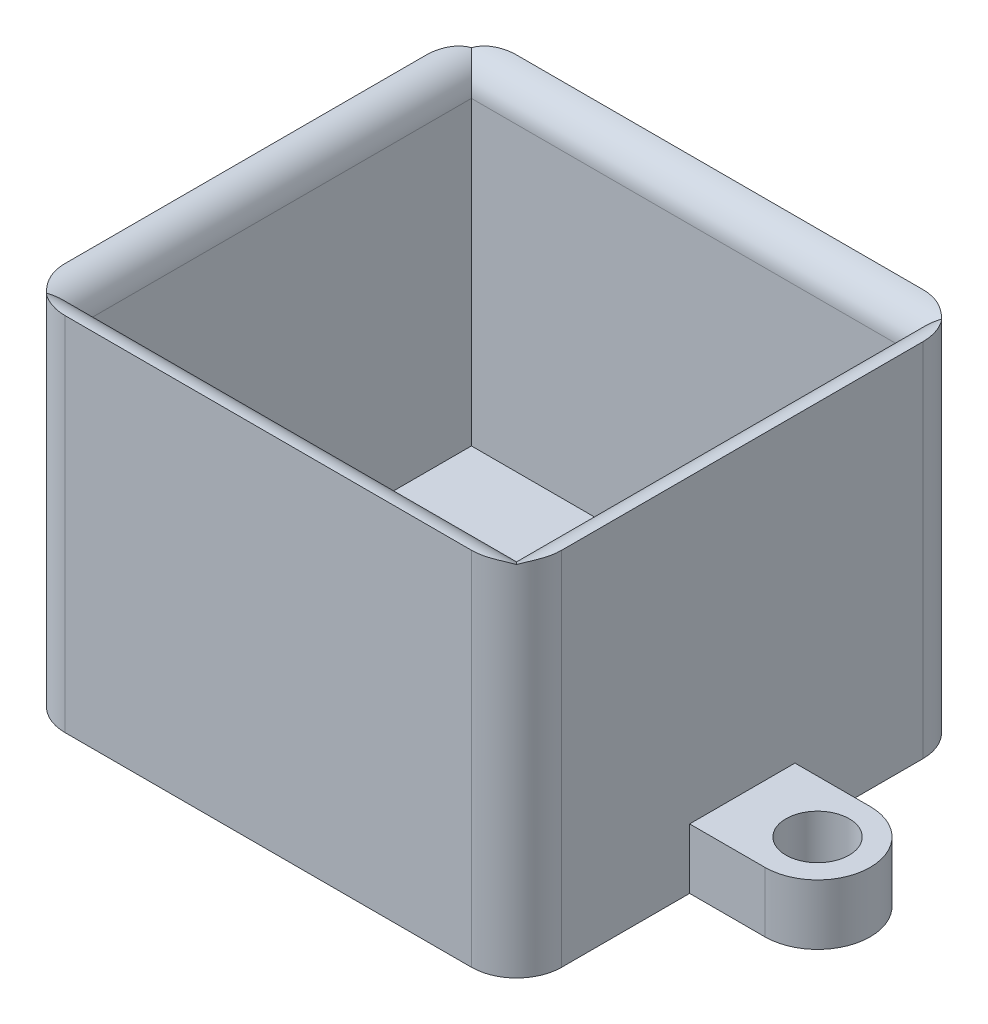
from build123d import *

# Parameters (mm, degrees)
SKETCH2_W           = 33
SKETCH2_H           = 30
SKETCH2_W_2         = 29
SKETCH2_H_2         = 26
BOSS_EXTRUDE1_DEPTH = 22
SKETCH3_W           = 33
SKETCH3_H           = 30
BOSS_EXTRUDE2_DEPTH = 2
SKETCH4_R           = 2.1
BOSS_EXTRUDE3_DEPTH = 4
FILLET1_R           = 3
FILLET2_R           = 2


with BuildPart() as part:
    # Sketch2 → Boss-Extrude1 (new body)
    with BuildSketch(Plane(origin=(0, 0, 0), x_dir=(1, 0, 0), z_dir=(0, 1, 0))):
        Rectangle(SKETCH2_W, SKETCH2_H)
        Rectangle(SKETCH2_W_2, SKETCH2_H_2, mode=Mode.SUBTRACT)
    extrude(amount=BOSS_EXTRUDE1_DEPTH)

    # Sketch3 → Boss-Extrude2 (add)
    with BuildSketch(Plane.XZ):
        Rectangle(SKETCH3_W, SKETCH3_H)
    extrude(amount=BOSS_EXTRUDE2_DEPTH)

    # Sketch4 → Boss-Extrude3 (add)
    # profile 1 of 2: a face of its own
    with BuildSketch(Plane.XZ.offset(2)):
        with BuildLine():
            Line((-21.5, 3.5), (-16.5, 3.5))
            Line((-16.5, 3.5), (-16.5, -3.5))
            Line((-16.5, -3.5), (-21.5, -3.5))
            ThreePointArc((-21.5, -3.5), (-25, 0), (-21.5, 3.5))
        make_face()
        with Locations(Location((-21.5, 0, 0), (0, 0, 270))):
            Circle(SKETCH4_R, mode=Mode.SUBTRACT)
    # profile 2 of 2: a face of its own
    with BuildSketch(Plane.XZ.offset(2)):
        with BuildLine():
            Line((16.5, 3.5), (16.5, -3.5))
            Line((16.5, -3.5), (21.5, -3.5))
            ThreePointArc((21.5, -3.5), (25, 0), (21.5, 3.5))
            Line((21.5, 3.5), (16.5, 3.5))
        make_face()
        with Locations(Location((21.5, 0, 0), (0, 0, 90))):
            Circle(SKETCH4_R, mode=Mode.SUBTRACT)
    extrude(amount=-BOSS_EXTRUDE3_DEPTH)

    # Fillet1
    fillet1_edges = [part.edges().sort_by_distance(p)[0] for p in [
        (16.5, 10, 15),
        (-16.5, 10, 15),
        (-16.5, 10, -15),
        (16.5, 10, -15),
    ]]
    fillet(fillet1_edges, radius=FILLET1_R)

    # Fillet2
    # the kernel refuses this fillet: 2 mm, written as the material it takes off along each edge
    with BuildSketch(Plane(origin=(14.5, 22, -13), x_dir=(1, 0, 0), z_dir=(0, 0, 1)), Plane(origin=(-14.5, 22, 13), x_dir=(-1, 0, 0), z_dir=(0, 0, -1))) as fillet2_piece_1:
        with BuildLine():
            CenterArc((FILLET2_R, -FILLET2_R), FILLET2_R, 90, 90)
            Line((0, -FILLET2_R), (-FILLET2_R * 0.02, -FILLET2_R))
            Line((-FILLET2_R * 0.02, -FILLET2_R), (-FILLET2_R * 0.02, FILLET2_R * 0.02))
            Line((-FILLET2_R * 0.02, FILLET2_R * 0.02), (FILLET2_R, FILLET2_R * 0.02))
            Line((FILLET2_R, FILLET2_R * 0.02), (FILLET2_R, 0))
        make_face()
    extrude(amount=26, mode=Mode.SUBTRACT)
    with BuildSketch(Plane(origin=(-14.5, 22, -13), x_dir=(0, 0, -1), z_dir=(1, 0, 0)), Plane(origin=(14.5, 22, 13), x_dir=(0, 0, 1), z_dir=(-1, 0, 0))) as fillet2_piece_2:
        with BuildLine():
            CenterArc((FILLET2_R, -FILLET2_R), FILLET2_R, 90, 90)
            Line((0, -FILLET2_R), (-FILLET2_R * 0.02, -FILLET2_R))
            Line((-FILLET2_R * 0.02, -FILLET2_R), (-FILLET2_R * 0.02, FILLET2_R * 0.02))
            Line((-FILLET2_R * 0.02, FILLET2_R * 0.02), (FILLET2_R, FILLET2_R * 0.02))
            Line((FILLET2_R, FILLET2_R * 0.02), (FILLET2_R, 0))
        make_face()
    extrude(amount=29, mode=Mode.SUBTRACT)
    with BuildSketch(Plane(origin=(14.5, 22, -18), x_dir=(1, 0, 0), z_dir=(0, 0, 1))) as fillet2_piece_3a_section:
        with BuildLine():
            CenterArc((FILLET2_R, -FILLET2_R), FILLET2_R, 90, 90)
            Line((0, -FILLET2_R), (-FILLET2_R * 0.02, -FILLET2_R))
            Line((-FILLET2_R * 0.02, -FILLET2_R), (-FILLET2_R * 0.02, FILLET2_R * 0.02))
            Line((-FILLET2_R * 0.02, FILLET2_R * 0.02), (FILLET2_R, FILLET2_R * 0.02))
            Line((FILLET2_R, FILLET2_R * 0.02), (FILLET2_R, 0))
        make_face()
    fillet2_piece_3a = extrude(amount=31, mode=Mode.PRIVATE)
    fillet2_piece_3a = split(fillet2_piece_3a, bisect_by=Plane(origin=(14.952790229, 21.547209771, -13), z_dir=(0, 0, -1)), keep=Keep.TOP, mode=Mode.PRIVATE)
    with BuildSketch(Plane(origin=(-14.5, 22, -13), x_dir=(0, 0, -1), z_dir=(1, 0, 0))) as fillet2_piece_3b_section:
        with BuildLine():
            CenterArc((FILLET2_R, -FILLET2_R), FILLET2_R, 90, 90)
            Line((0, -FILLET2_R), (-FILLET2_R * 0.02, -FILLET2_R))
            Line((-FILLET2_R * 0.02, -FILLET2_R), (-FILLET2_R * 0.02, FILLET2_R * 0.02))
            Line((-FILLET2_R * 0.02, FILLET2_R * 0.02), (FILLET2_R, FILLET2_R * 0.02))
            Line((FILLET2_R, FILLET2_R * 0.02), (FILLET2_R, 0))
        make_face()
    fillet2_piece_3b = extrude(amount=34, mode=Mode.PRIVATE)
    fillet2_piece_3b = split(fillet2_piece_3b, bisect_by=Plane(origin=(14.5, 21.547209771, -13.452790229), z_dir=(1, 0, 0)), keep=Keep.TOP, mode=Mode.PRIVATE)
    fillet2_piece_3 = fillet2_piece_3a & fillet2_piece_3b
    add(fillet2_piece_3, mode=Mode.SUBTRACT)
    with BuildSketch(Plane(origin=(19.5, 22, 13), x_dir=(0, 0, 1), z_dir=(-1, 0, 0))) as fillet2_piece_4a_section:
        with BuildLine():
            CenterArc((FILLET2_R, -FILLET2_R), FILLET2_R, 90, 90)
            Line((0, -FILLET2_R), (-FILLET2_R * 0.02, -FILLET2_R))
            Line((-FILLET2_R * 0.02, -FILLET2_R), (-FILLET2_R * 0.02, FILLET2_R * 0.02))
            Line((-FILLET2_R * 0.02, FILLET2_R * 0.02), (FILLET2_R, FILLET2_R * 0.02))
            Line((FILLET2_R, FILLET2_R * 0.02), (FILLET2_R, 0))
        make_face()
    fillet2_piece_4a = extrude(amount=34, mode=Mode.PRIVATE)
    fillet2_piece_4a = split(fillet2_piece_4a, bisect_by=Plane(origin=(14.5, 21.547209771, 13.452790229), z_dir=(1, 0, 0)), keep=Keep.TOP, mode=Mode.PRIVATE)
    with BuildSketch(Plane(origin=(14.5, 22, -13), x_dir=(1, 0, 0), z_dir=(0, 0, 1))) as fillet2_piece_4b_section:
        with BuildLine():
            CenterArc((FILLET2_R, -FILLET2_R), FILLET2_R, 90, 90)
            Line((0, -FILLET2_R), (-FILLET2_R * 0.02, -FILLET2_R))
            Line((-FILLET2_R * 0.02, -FILLET2_R), (-FILLET2_R * 0.02, FILLET2_R * 0.02))
            Line((-FILLET2_R * 0.02, FILLET2_R * 0.02), (FILLET2_R, FILLET2_R * 0.02))
            Line((FILLET2_R, FILLET2_R * 0.02), (FILLET2_R, 0))
        make_face()
    fillet2_piece_4b = extrude(amount=31, mode=Mode.PRIVATE)
    fillet2_piece_4b = split(fillet2_piece_4b, bisect_by=Plane(origin=(14.952790229, 21.547209771, 13), z_dir=(0, 0, 1)), keep=Keep.TOP, mode=Mode.PRIVATE)
    fillet2_piece_4 = fillet2_piece_4a & fillet2_piece_4b
    add(fillet2_piece_4, mode=Mode.SUBTRACT)
    with BuildSketch(Plane(origin=(-14.5, 22, 13), x_dir=(-1, 0, 0), z_dir=(0, 0, -1))) as fillet2_piece_5a_section:
        with BuildLine():
            CenterArc((FILLET2_R, -FILLET2_R), FILLET2_R, 90, 90)
            Line((0, -FILLET2_R), (-FILLET2_R * 0.02, -FILLET2_R))
            Line((-FILLET2_R * 0.02, -FILLET2_R), (-FILLET2_R * 0.02, FILLET2_R * 0.02))
            Line((-FILLET2_R * 0.02, FILLET2_R * 0.02), (FILLET2_R, FILLET2_R * 0.02))
            Line((FILLET2_R, FILLET2_R * 0.02), (FILLET2_R, 0))
        make_face()
    fillet2_piece_5a = extrude(amount=31, mode=Mode.PRIVATE)
    fillet2_piece_5a = split(fillet2_piece_5a, bisect_by=Plane(origin=(-14.952790229, 21.547209771, -13), z_dir=(0, 0, -1)), keep=Keep.TOP, mode=Mode.PRIVATE)
    with BuildSketch(Plane(origin=(-19.5, 22, -13), x_dir=(0, 0, -1), z_dir=(1, 0, 0))) as fillet2_piece_5b_section:
        with BuildLine():
            CenterArc((FILLET2_R, -FILLET2_R), FILLET2_R, 90, 90)
            Line((0, -FILLET2_R), (-FILLET2_R * 0.02, -FILLET2_R))
            Line((-FILLET2_R * 0.02, -FILLET2_R), (-FILLET2_R * 0.02, FILLET2_R * 0.02))
            Line((-FILLET2_R * 0.02, FILLET2_R * 0.02), (FILLET2_R, FILLET2_R * 0.02))
            Line((FILLET2_R, FILLET2_R * 0.02), (FILLET2_R, 0))
        make_face()
    fillet2_piece_5b = extrude(amount=34, mode=Mode.PRIVATE)
    fillet2_piece_5b = split(fillet2_piece_5b, bisect_by=Plane(origin=(-14.5, 21.547209771, -13.452790229), z_dir=(-1, 0, 0)), keep=Keep.TOP, mode=Mode.PRIVATE)
    fillet2_piece_5 = fillet2_piece_5a & fillet2_piece_5b
    add(fillet2_piece_5, mode=Mode.SUBTRACT)
    with BuildSketch(Plane(origin=(-14.5, 22, 18), x_dir=(-1, 0, 0), z_dir=(0, 0, -1))) as fillet2_piece_6a_section:
        with BuildLine():
            CenterArc((FILLET2_R, -FILLET2_R), FILLET2_R, 90, 90)
            Line((0, -FILLET2_R), (-FILLET2_R * 0.02, -FILLET2_R))
            Line((-FILLET2_R * 0.02, -FILLET2_R), (-FILLET2_R * 0.02, FILLET2_R * 0.02))
            Line((-FILLET2_R * 0.02, FILLET2_R * 0.02), (FILLET2_R, FILLET2_R * 0.02))
            Line((FILLET2_R, FILLET2_R * 0.02), (FILLET2_R, 0))
        make_face()
    fillet2_piece_6a = extrude(amount=31, mode=Mode.PRIVATE)
    fillet2_piece_6a = split(fillet2_piece_6a, bisect_by=Plane(origin=(-14.952790229, 21.547209771, 13), z_dir=(0, 0, 1)), keep=Keep.TOP, mode=Mode.PRIVATE)
    with BuildSketch(Plane(origin=(14.5, 22, 13), x_dir=(0, 0, 1), z_dir=(-1, 0, 0))) as fillet2_piece_6b_section:
        with BuildLine():
            CenterArc((FILLET2_R, -FILLET2_R), FILLET2_R, 90, 90)
            Line((0, -FILLET2_R), (-FILLET2_R * 0.02, -FILLET2_R))
            Line((-FILLET2_R * 0.02, -FILLET2_R), (-FILLET2_R * 0.02, FILLET2_R * 0.02))
            Line((-FILLET2_R * 0.02, FILLET2_R * 0.02), (FILLET2_R, FILLET2_R * 0.02))
            Line((FILLET2_R, FILLET2_R * 0.02), (FILLET2_R, 0))
        make_face()
    fillet2_piece_6b = extrude(amount=34, mode=Mode.PRIVATE)
    fillet2_piece_6b = split(fillet2_piece_6b, bisect_by=Plane(origin=(-14.5, 21.547209771, 13.452790229), z_dir=(-1, 0, 0)), keep=Keep.TOP, mode=Mode.PRIVATE)
    fillet2_piece_6 = fillet2_piece_6a & fillet2_piece_6b
    add(fillet2_piece_6, mode=Mode.SUBTRACT)


solid = part.part
